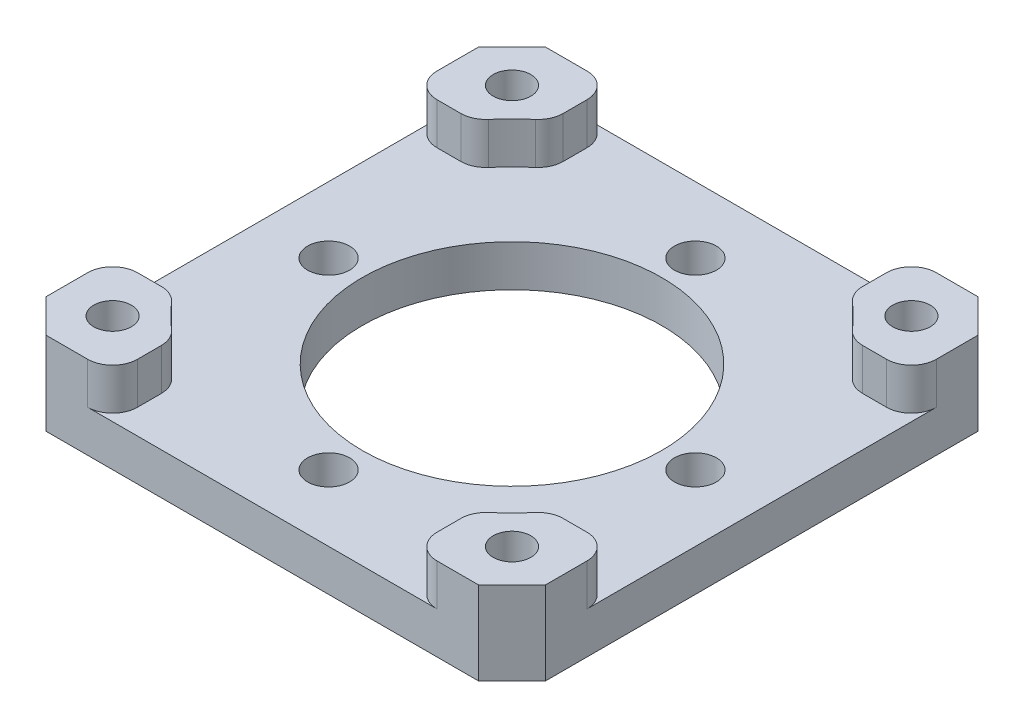
from build123d import *

# Parameters (mm, degrees)
SKETCH1_W                = 38.1
SKETCH1_H                = 38.1
SKETCH1_R                = 11.43
BOSS_EXTRUDE1_DEPTH      = 3.175
SKETCH2_R                = 1.6002
SKETCH2_R_2              = 1.4351
CUT_EXTRUDE1_DEPTH       = 28.127211891
CIRPATTERN1_COUNT        = 4
CHAMFER1_SIZE            = 2.54
BOSS_EXTRUDE2_START      = 3.175
SKETCH3_R                = 1.4351
BOSS_EXTRUDE2_DEPTH      = 3.175
FILLET1_R                = 1.905
CIRPATTERN7_COUNT        = 4
FILLET1_OF_CIRPATTERN7_R = 1.905


with BuildPart() as part:
    # Sketch1 → Boss-Extrude1 (new body)
    with BuildSketch(Plane(origin=(0, 0, 0), x_dir=(1, 0, 0), z_dir=(0, 1, 0))):
        Rectangle(SKETCH1_W, SKETCH1_H)
        Circle(SKETCH1_R, mode=Mode.SUBTRACT)
    extrude(amount=BOSS_EXTRUDE1_DEPTH)

    # Sketch2 → Cut-Extrude1 (cut, through all)
    with BuildSketch(Plane(origin=(0, 3.175, 0), x_dir=(1, 0, 0), z_dir=(0, 1, 0))):
        with Locations((0, 13.9954)):
            Circle(SKETCH2_R)
        with Locations((15.24, 15.24)):
            Circle(SKETCH2_R_2)
    cut_extrude1 = extrude(amount=-CUT_EXTRUDE1_DEPTH, mode=Mode.SUBTRACT)

    # CirPattern1: Cut-Extrude1 ×4 about axis
    cirpattern1_axis = Axis((0, 3.175, 0), (0, -1, 0))
    for i in range(1, CIRPATTERN1_COUNT):
        add(cut_extrude1.rotate(cirpattern1_axis, i * 360 / CIRPATTERN1_COUNT), mode=Mode.SUBTRACT)

    # Chamfer1
    chamfer1_edges = [part.edges().sort_by_distance(p)[0] for p in [
        (-19.05, 1.5875, 19.05),
        (19.05, 1.5875, 19.05),
        (19.05, 1.5875, -19.05),
        (-19.05, 1.5875, -19.05),
    ]]
    chamfer(chamfer1_edges, length=CHAMFER1_SIZE)

    # Sketch3 → Boss-Extrude2 (add)
    with BuildSketch(Plane(origin=(0, 3.175, 0), x_dir=(1, 0, 0), z_dir=(0, 1, 0)).offset(BOSS_EXTRUDE2_START)):
        with BuildLine():
            Line((-19.05, 16.51), (-19.05, 11.43))
            Line((-19.05, 11.43), (-14.438397591, 11.43))
            ThreePointArc((-14.438397591, 11.43), (-13.021371376, 13.021371376), (-11.43, 14.438397591))
            Line((-11.43, 14.438397591), (-11.43, 19.05))
            Line((-11.43, 19.05), (-16.51, 19.05))
            Line((-16.51, 19.05), (-19.05, 16.51))
        make_face()
        with Locations((-15.24, 15.24)):
            Circle(SKETCH3_R, mode=Mode.SUBTRACT)
    boss_extrude2 = extrude(amount=-BOSS_EXTRUDE2_DEPTH)

    # Fillet1
    fillet1_edges = [part.edges().sort_by_distance(p)[0] for p in [
        (-19.05, 4.7625, -11.43),
        (-11.43, 4.7625, -19.05),
        (-11.43, 4.7625, -14.438397591),
        (-14.438397591, 4.7625, -11.43),
    ]]
    fillet(fillet1_edges, radius=FILLET1_R)

    # CirPattern7: Boss-Extrude2 ×4 about axis
    cirpattern7_axis = Axis((0, 3.175, 0), (0, -1, 0))
    for i in range(1, CIRPATTERN7_COUNT):
        add(boss_extrude2.rotate(cirpattern7_axis, i * 360 / CIRPATTERN7_COUNT))

    # Fillet1 of CirPattern7
    fillet1_of_cirpattern7_edges = [part.edges().sort_by_distance(p)[0] for p in [
        (11.43, 4.7625, -19.05),
        (19.05, 4.7625, -11.43),
        (14.438397591, 4.7625, -11.43),
        (11.43, 4.7625, -14.438397591),
        (19.05, 4.7625, 11.43),
        (11.43, 4.7625, 19.05),
        (11.43, 4.7625, 14.438397591),
        (14.438397591, 4.7625, 11.43),
        (-11.43, 4.7625, 19.05),
        (-19.05, 4.7625, 11.43),
        (-14.438397591, 4.7625, 11.43),
        (-11.43, 4.7625, 14.438397591),
    ]]
    fillet(fillet1_of_cirpattern7_edges, radius=FILLET1_OF_CIRPATTERN7_R)


solid = part.part
